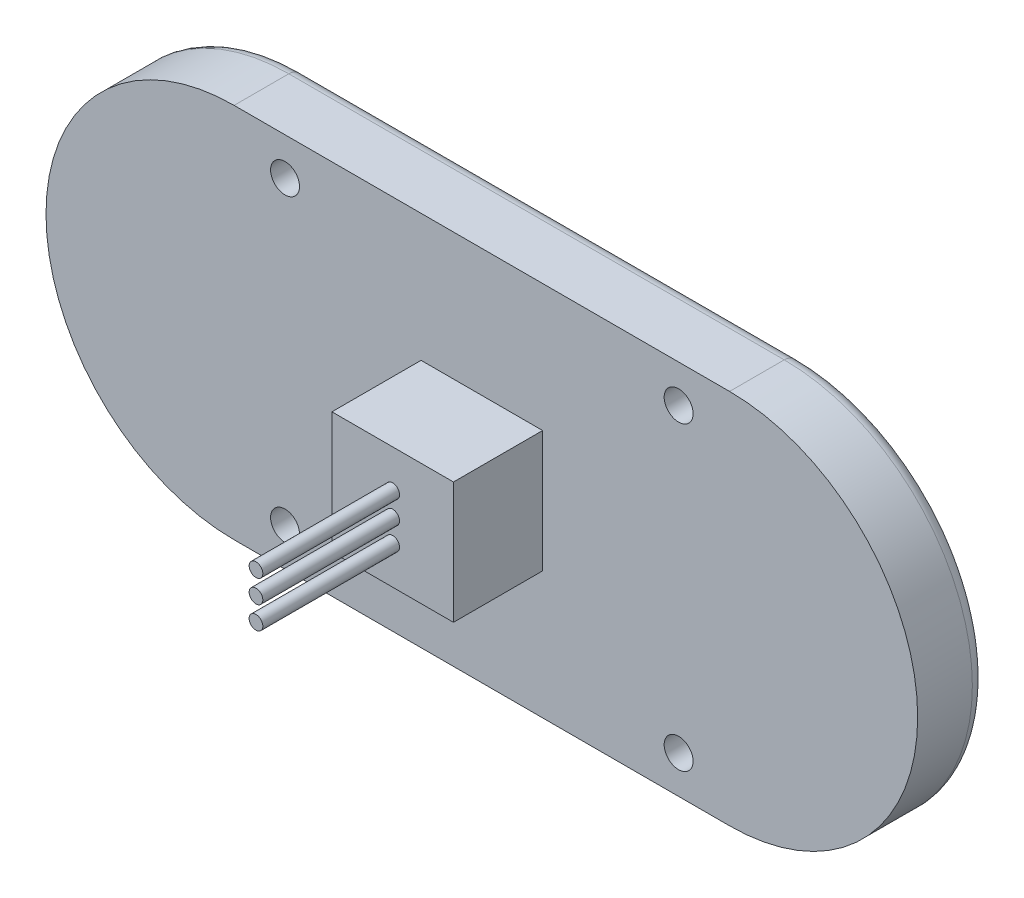
from build123d import *

# Parameters (mm, degrees)
SKETCH1_W           = 191.262
SKETCH1_H           = 82.55
SKETCH1_R           = 3.175
BOSS_EXTRUDE1_DEPTH = 5
FILLET1_R           = 41.275
SKETCH2_W           = 26.67
SKETCH2_H           = 26.67
BOSS_EXTRUDE2_DEPTH = 19.558
SKETCH3_R           = 1.5
BOSS_EXTRUDE3_DEPTH = 30
BOSS_EXTRUDE4_START = 10
SKETCH4_R           = 3.175
BOSS_EXTRUDE4_DEPTH = 10
FILLET2_R           = 3
BOSS_EXTRUDE5_DEPTH = 10
FILLET3_R           = 10


with BuildPart() as part:
    # Sketch1 → Boss-Extrude1 (new body)
    with BuildSketch(Plane.XY):
        Rectangle(SKETCH1_W, SKETCH1_H)
        with Locations((-43.18, 33.02)):
            Circle(SKETCH1_R, mode=Mode.SUBTRACT)
        with Locations((43.18, 33.02)):
            Circle(SKETCH1_R, mode=Mode.SUBTRACT)
        with Locations((-43.18, -33.02)):
            Circle(SKETCH1_R, mode=Mode.SUBTRACT)
        with Locations((43.18, -33.02)):
            Circle(SKETCH1_R, mode=Mode.SUBTRACT)
    extrude(amount=BOSS_EXTRUDE1_DEPTH)

    # Fillet1
    fillet1_edges = [part.edges().sort_by_distance(p)[0] for p in [
        (-95.631, 41.275, 2.5),
        (95.631, 41.275, 2.5),
        (95.631, -41.275, 2.5),
        (-95.631, -41.275, 2.5),
    ]]
    fillet(fillet1_edges, radius=FILLET1_R - 0.0001)  # a hair under: the kernel refuses the full size

    # Sketch2 → Boss-Extrude2 (add)
    with BuildSketch(Plane.XY.offset(5)):
        Rectangle(SKETCH2_W, SKETCH2_H)
    extrude(amount=BOSS_EXTRUDE2_DEPTH)

    # Sketch3 → Boss-Extrude3 (add)
    with BuildSketch(Plane.XY.offset(24.558)):
        with Locations((0, 5)):
            Circle(SKETCH3_R)
        Circle(SKETCH3_R)
        with Locations((0, -5)):
            Circle(SKETCH3_R)
    extrude(amount=BOSS_EXTRUDE3_DEPTH)

    # Sketch4 → Boss-Extrude4 (add)
    with BuildSketch(Plane(origin=(0, 0, 0), x_dir=(-1, 0, 0), z_dir=(0, 0, -1)).offset(BOSS_EXTRUDE4_START)):
        with BuildLine():
            Line((-54.356, 41.275), (54.356, 41.275))
            ThreePointArc((54.356, 41.275), (95.631, 0), (54.356, -41.275))
            Line((54.356, -41.275), (-54.356, -41.275))
            ThreePointArc((-54.356, -41.275), (-95.631, 0), (-54.356, 41.275))
        make_face()
        with Locations((-43.18, 33.02)):
            Circle(SKETCH4_R, mode=Mode.SUBTRACT)
        with Locations((43.18, 33.02)):
            Circle(SKETCH4_R, mode=Mode.SUBTRACT)
        with Locations((43.18, -33.02)):
            Circle(SKETCH4_R, mode=Mode.SUBTRACT)
        with Locations((-43.18, -33.02)):
            Circle(SKETCH4_R, mode=Mode.SUBTRACT)
    extrude(amount=-BOSS_EXTRUDE4_DEPTH)

    # Fillet2
    fillet2_edges = [part.edges().sort_by_distance(p)[0] for p in [
        (95.631, 0, -10),
        (0, -41.275, -10),
        (-95.631, 0, -10),
        (0, 41.275, -10),
    ]]
    fillet(fillet2_edges, radius=FILLET2_R)

    # Sketch5 → Boss-Extrude5 (add)
    with BuildSketch(Plane(origin=(0, 0, -10), x_dir=(-1, 0, 0), z_dir=(0, 0, -1))):
        with BuildLine():
            Line((-54.356, 25), (54.356, 25))
            ThreePointArc((54.356, 25), (79.356, 0), (54.356, -25))
            Line((54.356, -25), (-54.356, -25))
            ThreePointArc((-54.356, -25), (-79.356, 0), (-54.356, 25))
        make_face()
    extrude(amount=BOSS_EXTRUDE5_DEPTH)

    # Fillet3
    fillet3_edges = [part.edges().sort_by_distance(p)[0] for p in [
        (79.356, 0, -20),
        (0, -25, -20),
        (-79.356, 0, -20),
        (0, 25, -20),
    ]]
    fillet(fillet3_edges, radius=FILLET3_R - 0.0001)  # a hair under: the kernel refuses the full size


solid = part.part
